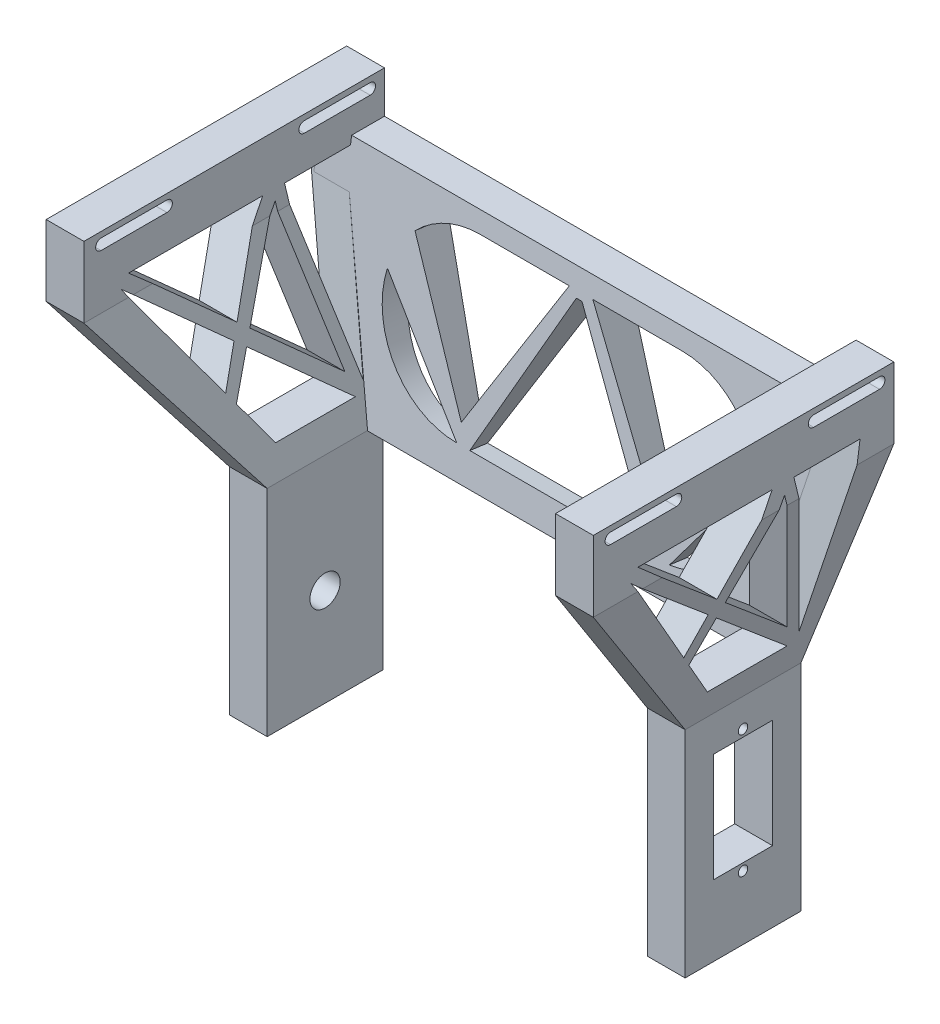
from build123d import *

# Parameters (mm, degrees)
BOSS_EXTRU_1_DEPTH                    = 40.5
BOSS_EXTRU_1_DEPTH_BACK               = 5
ESQUISSE1_W                           = 8
ESQUISSE1_H                           = 24.5
BOSS_EXTRU_1_2_DEPTH                  = 40.5
BOSS_EXTRU_1_2_DEPTH_BACK             = 5
ESQUISSE3_R                           = 3.2
ENL_V_MAT_EXTRU_1_DEPTH               = 10.5
ESQUISSE4_W                           = 12.5
ESQUISSE4_H                           = 23
ENL_V_MAT_EXTRU_2_DEPTH               = 10.5
ESQUISSE5_W                           = 8
ESQUISSE5_H                           = 63.6
BOSS_EXTRU_2_DEPTH                    = 15
BOSS_EXTRU_2_2_DEPTH                  = 15
ENL_V_MAT_EXTRU_3_DEPTH               = 156.691080348
ENL_V_START                           = -115.8
ENL_V_MAT_EXTRU_6_DEPTH               = 17.675
ENL_V_START_2                         = -17.675
ENL_V_MAT_EXTRU_6_2_DEPTH             = 17.675
BOSS_EXTRU_3_DEPTH                    = 106.5
ENL_VEMENT_START                      = -22.25
ENL_VEMENT_DE_MATI_RE_BALAYAGE1_DEPTH = 63.6
ENL_VEMENT_DE_MATI_RE_BALAYAGE2_DEPTH = 63.6
ENL_V_MAT_EXTRU_11_DEPTH              = 14
ESQUISSE14_R                          = 1
ENL_V_MAT_EXTRU_12_DEPTH              = 14


with BuildPart() as part:
    # Esquisse1 → Boss.-Extru.1 (new, two sides: drawn at the far end of the back side and taken through both)
    with BuildSketch(Plane(origin=(0, 0, 0), x_dir=(1, 0, 0), z_dir=(0, 1, 0)).offset(-BOSS_EXTRU_1_DEPTH_BACK)):
        with Locations((-44.225, 0)):
            Rectangle(ESQUISSE1_W, ESQUISSE1_H)
    extrude(amount=BOSS_EXTRU_1_DEPTH + BOSS_EXTRU_1_DEPTH_BACK)

    # Esquisse3 → Enlèv. mat.-Extru.1 (cut)
    with BuildSketch(Plane.ZY.offset(48.225)):
        with Locations((0, 15.67)):
            Circle(ESQUISSE3_R)
    extrude(amount=-ENL_V_MAT_EXTRU_1_DEPTH, mode=Mode.SUBTRACT)


with BuildPart() as body_2:
    # Esquisse1 → Boss.-Extru.1 2 (new, two sides: drawn at the far end of the back side and taken through both)
    with BuildSketch(Plane(origin=(0, 0, 0), x_dir=(1, 0, 0), z_dir=(0, 1, 0)).offset(-BOSS_EXTRU_1_2_DEPTH_BACK)):
        with Locations((44.225, 0)):
            Rectangle(ESQUISSE1_W, ESQUISSE1_H)
    extrude(amount=BOSS_EXTRU_1_2_DEPTH + BOSS_EXTRU_1_2_DEPTH_BACK)

    # Esquisse4 → Enlèv. mat.-Extru.2 (cut)
    with BuildSketch(Plane(origin=(48.225, 0, 0), x_dir=(0, 0, -1), z_dir=(1, 0, 0))):
        with Locations((0, 21.5)):
            Rectangle(ESQUISSE4_W, ESQUISSE4_H)
    extrude(amount=-ENL_V_MAT_EXTRU_2_DEPTH, mode=Mode.SUBTRACT)


with BuildPart() as body_3:
    # Esquisse5 → Boss.-Extru.2 (new body)
    with BuildSketch(Plane(origin=(0, 80.5, 0), x_dir=(1, 0, 0), z_dir=(0, 1, 0))):
        with Locations((-53.9, -9.55)):
            Rectangle(ESQUISSE5_W, ESQUISSE5_H)
    extrude(amount=BOSS_EXTRU_2_DEPTH)


with BuildPart() as body_4:
    # Esquisse5 → Boss.-Extru.2 2 (new body)
    with BuildSketch(Plane(origin=(0, 80.5, 0), x_dir=(1, 0, 0), z_dir=(0, 1, 0))):
        with Locations((53.9, -9.55)):
            Rectangle(ESQUISSE5_W, ESQUISSE5_H)
    extrude(amount=BOSS_EXTRU_2_2_DEPTH)


with BuildPart() as enl_v_mat_extru_3_tool:
    # Esquisse6 → Enlèv. mat.-Extru.3 (new, through all)
    with BuildSketch(Plane.ZY.offset(57.9)):
        with BuildLine():
            Line((-19.215648746, 94.3), (-5.284351254, 94.3))
            ThreePointArc((-5.284351254, 94.3), (-4.134351254, 93.15), (-5.284351254, 92))
            Line((-5.284351254, 92), (-19.215648746, 92))
            ThreePointArc((-19.215648746, 92), (-20.365648746, 93.15), (-19.215648746, 94.3))
        make_face()
        with BuildLine():
            Line((23.784351254, 94.3), (37.715648746, 94.3))
            ThreePointArc((37.715648746, 94.3), (38.865648746, 93.15), (37.715648746, 92))
            Line((37.715648746, 92), (23.784351254, 92))
            ThreePointArc((23.784351254, 92), (22.634351254, 93.15), (23.784351254, 94.3))
        make_face()
    extrude(amount=-ENL_V_MAT_EXTRU_3_DEPTH)


with BuildPart() as body_3_1:
    add(body_3.part)

    # Enlèv. mat.-Extru.3: cut by enl_v_mat_extru_3_tool
    add(enl_v_mat_extru_3_tool.part, mode=Mode.SUBTRACT)


    add(part.part)  # lissage2 joins it to this body
    # loft from a face of the part (lissage2)
    loft([body_3_1.faces().sort_by_distance((-53.9, 80.5, 9.55))[0], body_3_1.faces().sort_by_distance((-44.225, 40.5, 0))[0]])

    # Enl_v. mat.-Extru.6 2 outline → Enl_v. mat.-Extru.6 2 (cut)
    with BuildSketch(Plane.ZY.offset(57.9).offset(ENL_V_START_2)):
        Polygon((16.7851704, 58.061718477), (33.416643679, 82.714263273), (13.314021784, 65.095678551), align=None)
        Polygon((-7.878685189, 46.521708187), (8.999873816, 46.521708187), (15.109936371, 55.57854809), (11.118967449, 63.171862295), align=None)
        Polygon((3.513606596, 84.955309113), (12.07666079, 67.60307561), (31.90475538, 84.955309113), align=None)
        Polygon((-1.093401297, 84.955309113), (-15.094337023, 84.955309113), (-9.967028833, 48.311900258), align=None)
        Polygon((9.825440903, 65.632957253), (0.873750807, 82.664659801), (-6.767009008, 51.112345403), align=None)
    extrude(amount=ENL_V_MAT_EXTRU_6_2_DEPTH, mode=Mode.SUBTRACT)



with BuildPart() as body_4_1:
    add(body_4.part)

    # Enlèv. mat.-Extru.3: cut by enl_v_mat_extru_3_tool
    add(enl_v_mat_extru_3_tool.part, mode=Mode.SUBTRACT)


    add(body_2.part)  # lissage1 joins it to this body
    # loft from a face of the part (lissage1)
    loft([body_4_1.faces().sort_by_distance((53.9, 80.5, 9.55))[0], body_4_1.faces().sort_by_distance((44.225, 40.5, 0))[0]])

    # Enlèv. mat.-Extru.6: read off the stored shape, not the designer's step
    # Enlèv. mat.-Extru.6 outline → Enlèv. mat.-Extru.6 (cut)
    with BuildSketch(Plane.ZY.offset(57.9).offset(ENL_V_START)):
        Polygon((16.7851704, 58.061718477), (33.416643679, 82.714263273), (13.314021784, 65.095678551), align=None)
        Polygon((-7.878685189, 46.521708187), (8.999873816, 46.521708187), (15.109936371, 55.57854809), (11.118967449, 63.171862295), align=None)
        Polygon((3.513606596, 84.955309113), (12.07666079, 67.60307561), (31.90475538, 84.955309113), align=None)
        Polygon((-1.093401297, 84.955309113), (-15.094337023, 84.955309113), (-9.967028833, 48.311900258), align=None)
        Polygon((9.825440903, 65.632957253), (0.873750807, 82.664659801), (-6.767009008, 51.112345403), align=None)
    extrude(amount=ENL_V_MAT_EXTRU_6_DEPTH, mode=Mode.SUBTRACT)


with BuildPart() as body_3_2:
    add(body_3_1.part)

    add(body_4_1.part)  # Boss.-Extru.3 merges body 4
    # Esquisse9 → Boss.-Extru.3 (add)
    with BuildSketch(Plane.ZY.offset(-49.9)):
        Polygon((-22.25, 86.627151597), (-15.29778178, 86.627151597), (-8.984735346, 40.434496389), (-12.141258563, 40.434496389), (-22.25, 80.5), align=None)
    extrude(amount=BOSS_EXTRU_3_DEPTH)

    # Enlèvement de matière-Balayage1: read off the stored shape, not the designer's step
    # Enlèvement de matière-Balayage1 outline → Enlèvement de matière-Balayage1 (cut)
    with BuildSketch(Plane.XY.offset(ENL_VEMENT_START)):
        Polygon((49.9, 47.425064599), (48.225, 40.5), (48.225, 40.434496389), (49.9, 40.434496389), align=None)
    extrude(amount=ENL_VEMENT_DE_MATI_RE_BALAYAGE1_DEPTH, mode=Mode.SUBTRACT)

    # Enlèvement de matière-Balayage2: read off the stored shape, not the designer's step
    # Enlèvement de matière-Balayage2 outline → Enlèvement de matière-Balayage2 (cut)
    with BuildSketch(Plane.XY.offset(ENL_VEMENT_START)):
        Polygon((-48.225, 40.5), (-56.6, 75.125322997), (-56.6, 40.434496389), (-48.225, 40.434496389), align=None)
    extrude(amount=ENL_VEMENT_DE_MATI_RE_BALAYAGE2_DEPTH, mode=Mode.SUBTRACT)

    # Esquisse11 → Enlèv. mat.-Extru.11 (cut)
    with BuildSketch(Plane(origin=(0, -0.46401808, -3.395227235), x_dir=(1, 0, 0), z_dir=(0, 0.13540901456567775, 0.9907897853603217))):
        with BuildLine():
            Line((-3.287535233, 83.840431949), (-22.194472995, 83.840431949))
            ThreePointArc((-22.194472995, 83.840431949), (-29.253068949, 82.405282441), (-35.190824132, 78.327722591))
            Line((-35.190824132, 78.327722591), (-21.755006049, 51.469546885))
            Line((-21.755006049, 51.469546885), (-3.287535233, 83.840431949))
        make_face()
        with BuildLine():
            Line((-22.194472995, 47.688497503), (-39.849249541, 69.643827584))
            ThreePointArc((-39.849249541, 69.643827584), (-36.281059291, 54.43712269), (-22.194472995, 47.688497503))
        make_face()
        Polygon((-1.60521279, 82.498170098), (-19.443998314, 47.688497503), (18.984093957, 47.688497503), (-0.418307097, 82.498170098), align=None)
        with BuildLine():
            Line((20.617642495, 83.840431949), (1.70297306, 83.840431949))
            Line((1.70297306, 83.840431949), (21.304692687, 50.51147286))
            Line((21.304692687, 50.51147286), (33.613993633, 78.327722591))
            ThreePointArc((33.613993633, 78.327722591), (27.676238449, 82.405282441), (20.617642495, 83.840431949))
        make_face()
        with BuildLine():
            ThreePointArc((22.784876191, 47.818888972), (35.359080989, 55.303557395), (38.272419041, 69.643827584))
            Line((38.272419041, 69.643827584), (22.784876191, 47.818888972))
        make_face()
    extrude(amount=-ENL_V_MAT_EXTRU_11_DEPTH, mode=Mode.SUBTRACT)

    # Esquisse14 → Enlèv. mat.-Extru.12 (cut)
    with BuildSketch(Plane.ZY.offset(-40.225)):
        with Locations((0, 34.5)):
            Circle(ESQUISSE14_R)
        with Locations(Location((0, 8.5, 0), (0, 0, 180))):
            Circle(ESQUISSE14_R)
    extrude(amount=-ENL_V_MAT_EXTRU_12_DEPTH, mode=Mode.SUBTRACT)


solid = body_3_2.part
